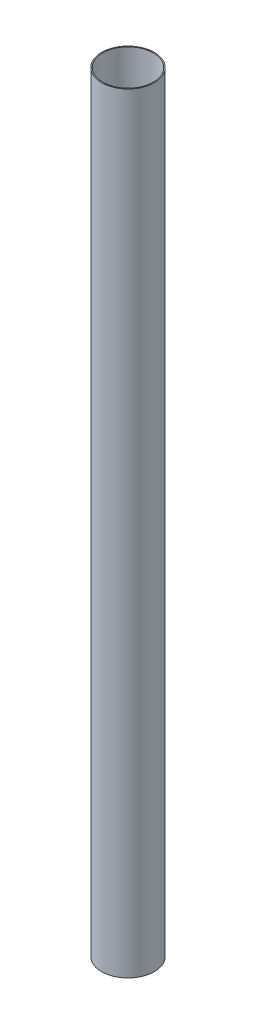
from build123d import *

# Parameters (mm, degrees)
ESBO_O1_R                = 26
ESBO_O1_R_2              = 25
RESSALTO_EXTRUS_O1_DEPTH = 760


with BuildPart() as part:
    # Esboço1 → Ressalto-extrusão1 (new body)
    with BuildSketch(Plane(origin=(0, 0, 0), x_dir=(1, 0, 0), z_dir=(0, 1, 0))):
        Circle(ESBO_O1_R)
        Circle(ESBO_O1_R_2, mode=Mode.SUBTRACT)
    extrude(amount=RESSALTO_EXTRUS_O1_DEPTH)


solid = part.part
